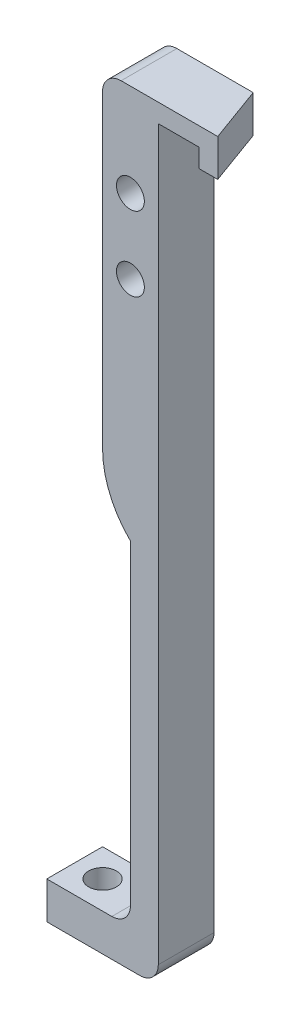
from build123d import *

# Parameters (mm, degrees)
SKETCH1_W             = 7.62
SKETCH1_H             = 104.648
BOSS_EXTRUDE1_DEPTH   = 7.62
SKETCH2_W             = 7.62
SKETCH2_H             = 5.08
BOSS_EXTRUDE2_DEPTH   = 7.62
SKETCH4_W             = 7.62
SKETCH4_H             = 2.54
BOSS_EXTRUDE3_DEPTH   = 8.128
BOSS_EXTRUDE4_DEPTH   = 2.54
F_6_CLEARANCE_HOLE1_D = 3.7973
CUT_EXTRUDE1_DEPTH    = 2.54
SKETCH12_W            = 7.62
SKETCH12_H            = 45.72
CUT_EXTRUDE2_DEPTH    = 3.81
FILLET2_R             = 12.7
FILLET3_R             = 2.54
SKETCH14_R            = 1.905
CUT_EXTRUDE4_DEPTH    = 107.100272422


with BuildPart() as part:
    # Sketch1 → Boss-Extrude1 (new body)
    with BuildSketch(Plane(origin=(0, 0, 0), x_dir=(0, 0, -1), z_dir=(1, 0, 0))):
        with Locations((3.81, 52.324)):
            Rectangle(SKETCH1_W, SKETCH1_H)
    extrude(amount=BOSS_EXTRUDE1_DEPTH)

    # Sketch2 → Boss-Extrude2 (add)
    with BuildSketch(Plane.ZY):
        with Locations((-3.81, 2.54)):
            Rectangle(SKETCH2_W, SKETCH2_H)
    extrude(amount=BOSS_EXTRUDE2_DEPTH)

    # Sketch4 → Boss-Extrude3 (add)
    with BuildSketch(Plane(origin=(7.62, 0, 0), x_dir=(0, 0, -1), z_dir=(1, 0, 0))):
        with Locations((3.81, 103.378)):
            Rectangle(SKETCH4_W, SKETCH4_H)
    extrude(amount=BOSS_EXTRUDE3_DEPTH)

    # Sketch5 → Boss-Extrude4 (add)
    with BuildSketch(Plane.XZ.offset(-102.108)):
        Polygon((15.748, 0), (12.974546815, -7.62), (10.434546815, -7.62), (13.208, 0), align=None)
    extrude(amount=BOSS_EXTRUDE4_DEPTH)

    # #6 Clearance Hole1 (through all)
    with Locations(Plane(origin=(0, 5.08, 0), x_dir=(1, 0, 0), z_dir=(0, 1, 0))):
        with Locations((-3.81, 3.81)):
            Hole(F_6_CLEARANCE_HOLE1_D / 2)

    # Sketch8 → Cut-Extrude1 (cut)
    with BuildSketch(Plane.XZ.offset(-102.108)):
        Polygon((15.748, -7.62), (12.974546815, -7.62), (15.748, 0), align=None)
    extrude(amount=-CUT_EXTRUDE1_DEPTH, mode=Mode.SUBTRACT)

    # Sketch12 → Cut-Extrude2 (cut)
    with BuildSketch(Plane.ZY):
        with Locations((-3.81, 27.94)):
            Rectangle(SKETCH12_W, SKETCH12_H)
    extrude(amount=-CUT_EXTRUDE2_DEPTH, mode=Mode.SUBTRACT)

    # Fillet2
    # the kernel refuses this fillet: 12.7 mm, written as the material it takes off along each edge
    with BuildSketch(Plane(origin=(0, 50.8, 22.674035261), x_dir=(1, 0, 0), z_dir=(0, 0, -1))) as fillet2_piece_1:
        with BuildLine():
            CenterArc((12.7, -9.069614104), FILLET2_R, 134.427004001, 45.572995999)
            Line((0, -9.069614104), (-0.254, -9.069614104))
            Line((-0.254, -9.069614104), (-0.254, 0))
            Line((-0.254, 0), (0, 0.254))
            ThreePointArc((0, 0.254), (1.905, 0.254), (3.6322, 0.181392282))
            Line((3.6322, 0.181392282), (3.81, 0))
        make_face()
    extrude(amount=52.968070521, mode=Mode.SUBTRACT)

    # Fillet3
    fillet3_edges = [part.edges().sort_by_distance(p)[0] for p in [
        (3.81, 5.08, -3.81),
        (7.62, 0, -3.81),
        (0, 104.648, -3.81),
    ]]
    fillet(fillet3_edges, radius=FILLET3_R)

    # Sketch14 → Cut-Extrude4 (cut, through all)
    with BuildSketch(Plane.XY):
        with Locations((3.81, 91.948)):
            Circle(SKETCH14_R)
        with Locations((3.81, 81.788)):
            Circle(SKETCH14_R)
    extrude(amount=-CUT_EXTRUDE4_DEPTH, mode=Mode.SUBTRACT)


solid = part.part
